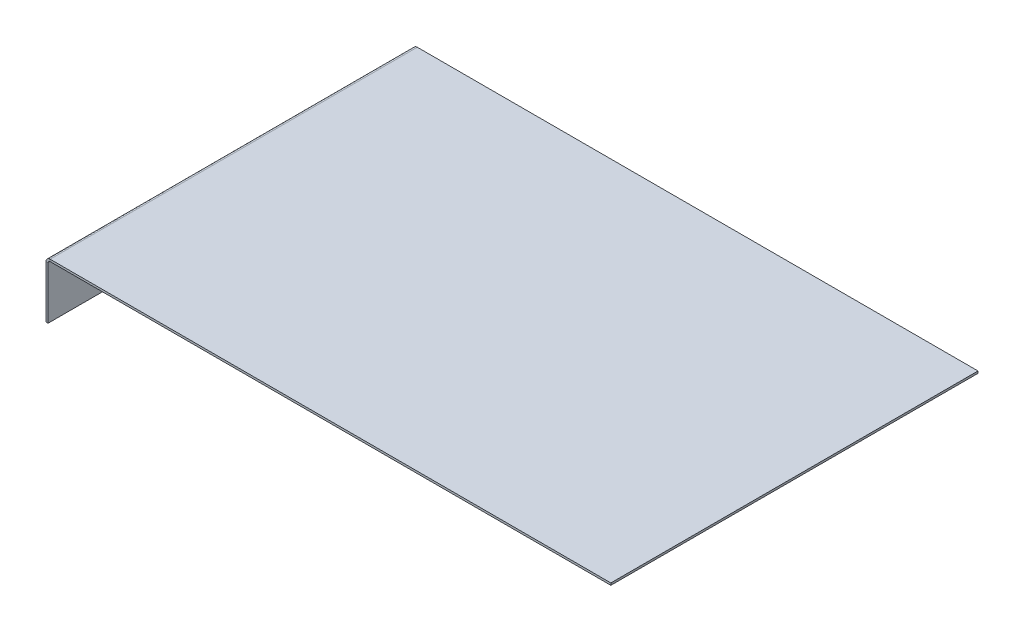
from build123d import *

# Parameters (mm, degrees)
SKETCH1_W                    = 200
SKETCH1_H                    = 130
BASE_FLANGE1_DEPTH           = 0.7366
EDGE_FLANGE1_STRIP_W         = 4.4196
EDGE_FLANGE1_STRIP_H         = 0.7366
EDGE_FLANGE1_STRIP_CUT_DEPTH = 130
EDGE_FLANGE1_DEPTH           = 130


# Sheet-metal steps are written as plain solids
with BuildPart() as part:
    # Sketch1 → Base-Flange1 (new body)
    with BuildSketch(Plane(origin=(0, 0, 0), x_dir=(1, 0, 0), z_dir=(0, 1, 0))):
        Rectangle(SKETCH1_W, SKETCH1_H)
    extrude(amount=-BASE_FLANGE1_DEPTH)

    # Edge-Flange1 strip (across the edge) → Edge-Flange1 strip cut (cut)
    with BuildSketch(Plane(origin=(-100, -0.7366, 65), x_dir=(1, 0, 0), z_dir=(0, 0, -1))):
        with Locations((-0.7366, -0.3683)):
            Rectangle(EDGE_FLANGE1_STRIP_W, EDGE_FLANGE1_STRIP_H)
    extrude(amount=EDGE_FLANGE1_STRIP_CUT_DEPTH, mode=Mode.SUBTRACT)

    # Edge-Flange1 section (across the edge) → Edge-Flange1 (add)
    with BuildSketch(Plane(origin=(-100, -0.7366, 65), x_dir=(1, 0, 0), z_dir=(0, 0, -1))):
        with BuildLine():
            Line((0, 0.7366), (0, 19.2634))
            Line((0, 19.2634), (0.7366, 19.2634))
            Line((0.7366, 19.2634), (0.7366, 0.7366))
            ThreePointArc((0.7366, 0.7366), (0.952345145, 0.215745145), (1.4732, 0))
            Line((1.4732, 0), (1.4732, -0.7366))
            ThreePointArc((1.4732, -0.7366), (0.43149029, -0.30510971), (0, 0.7366))
        make_face()
    extrude(amount=EDGE_FLANGE1_DEPTH)


solid = part.part
